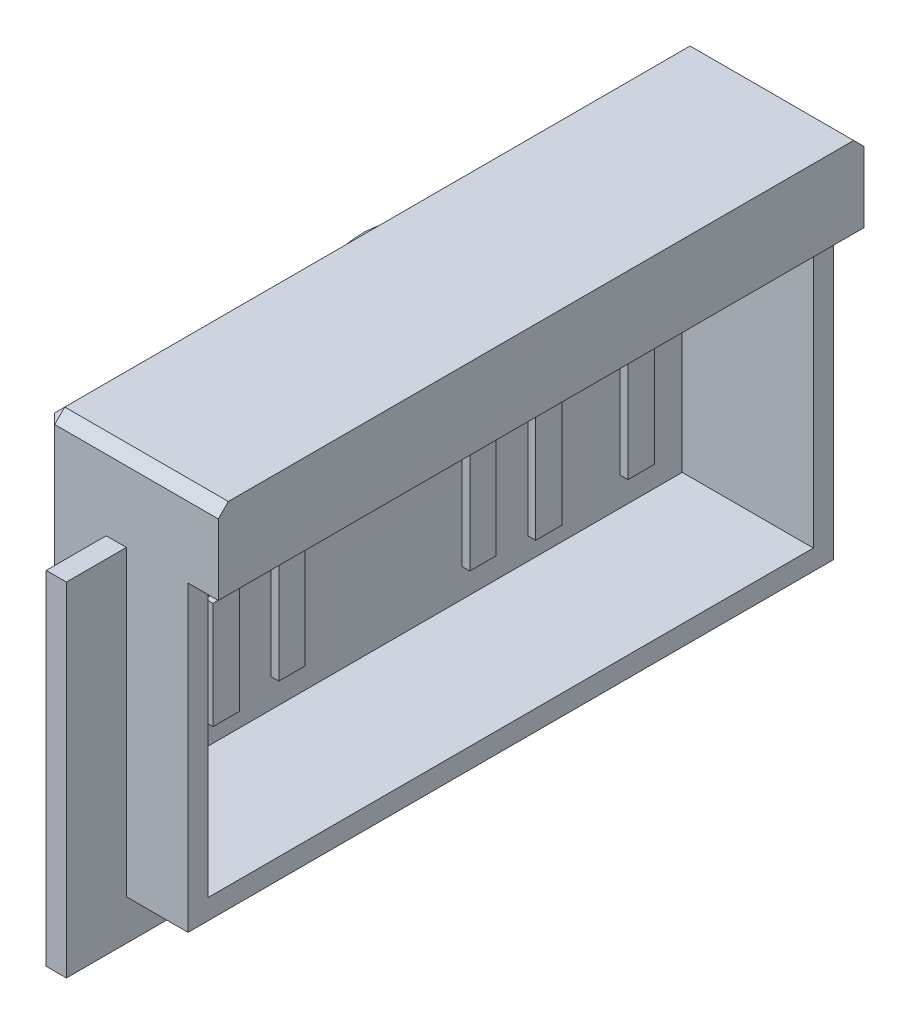
from build123d import *

# Parameters (mm, degrees)
EXTRUDE_1_DEPTH        = 38
SKETCH_2_W             = 60
SKETCH_2_H             = 34
CUT_EXTRUDE_1_DEPTH    = 13
SKETCH_3_R             = 5
SKETCH_3_W             = 2.616489735
SKETCH_3_H             = 10.586779654
SKETCH_3_W_2           = 2.616489734
CUT_EXTRUDE_4_DEPTH    = 31
SKETCH_4_W             = 2
SKETCH_4_H             = 75.8952895
EXTRUDE_3_DEPTH        = 4
SKETCH_5_W             = 5.94764475
SKETCH_5_H             = 8
CUT_EXTRUDE_5_DEPTH    = 4
SKETCH_6_W             = 64
SKETCH_6_H             = 8
EXTRUDE_4_DEPTH        = 3
SKETCH_8_W             = 4.58998673
SKETCH_8_H             = 12.393014206
SKETCH_8_W_2           = 2.616489734
SKETCH_8_H_2           = 10.586779654
EXTRUDE_12_DEPTH       = 0.5
SKETCH_8_W_3           = 4.589986731
SKETCH_8_W_4           = 2.616489735
EXTRUDE_12_2_DEPTH     = 0.5
EXTRUDE_12_3_DEPTH     = 0.5
EXTRUDE_12_4_DEPTH     = 0.5
SKETCH_8_W_5           = 2.638161598
SKETCH_8_H_3           = 10.599647323
EXTRUDE_12_5_DEPTH     = 0.5
EXTRUDE_12_6_DEPTH     = 0.5
EXTRUDE_5_DEPTH        = 1.5
EXTRUDE_5_DEPTH_BACK   = 2
SKETCH_7_W             = 2.616489735
SKETCH_7_H             = 10.586779654
EXTRUDE_5_2_DEPTH      = 1.5
EXTRUDE_5_2_DEPTH_BACK = 2
SKETCH_7_W_2           = 2.616489734
EXTRUDE_5_3_DEPTH      = 1.5
EXTRUDE_5_3_DEPTH_BACK = 2
EXTRUDE_5_4_DEPTH      = 1.5
EXTRUDE_5_4_DEPTH_BACK = 2
SKETCH_7_W_3           = 2.605653804
SKETCH_7_H_2           = 10.58034582
EXTRUDE_5_5_DEPTH      = 1.5
EXTRUDE_5_5_DEPTH_BACK = 2
EXTRUDE_5_6_DEPTH      = 1.5
EXTRUDE_5_6_DEPTH_BACK = 2
SKETCH_7_W_4           = 2.605653803
SKETCH_9_R             = 5
EXTRUDE_13_DEPTH       = 0.5
EXTRUDE_13_2_DEPTH     = 0.5
SKETCH_10_R            = 8.168620066
EXTRUDE_16_DEPTH       = 0.5
SKETCH_11_R            = 3.519491785
EXTRUDE_17_DEPTH       = 1
SKETCH_12_R            = 4.165923427
SKETCH_12_R_2          = 3.519491785
EXTRUDE_18_DEPTH       = 2
SKETCH_13_R            = 1.99985973
CUT_EXTRUDE_6_DEPTH    = 2
CHAMFER_1_SIZE         = 1


with BuildPart() as part:
    # 草图1 → 凸台-拉伸1 (new body)
    with BuildSketch(Plane(origin=(0, 0, 0), x_dir=(1, 0, 0), z_dir=(0, 1, 0))):
        Polygon((-2, 5.94764475), (-2, 0), (0, 0), (0, 5.94764475), (6.11103449, 5.94764475), (6.11103449, 69.94764475), (0, 69.94764475), (0, 75.8952895), (-2, 75.8952895), (-2, 69.94764475), (-8.11103449, 69.94764475), (-8.11103449, 5.94764475), align=None)
    extrude(amount=EXTRUDE_1_DEPTH)

    # 草图2 → 切除-拉伸1 (cut)
    with BuildSketch(Plane(origin=(6.11103449, 0, 0), x_dir=(0, 0, -1), z_dir=(1, 0, 0))):
        with Locations((37.94764475, 19)):
            Rectangle(SKETCH_2_W, SKETCH_2_H)
    extrude(amount=-CUT_EXTRUDE_1_DEPTH, mode=Mode.SUBTRACT)

    # 草图3 → 切除-拉伸4 (cut)
    with BuildSketch(Plane.ZY.offset(8.11103449)):
        with Locations((-53.94764475, 28.5)):
            Circle(SKETCH_3_R)
        with Locations((-63.098105483, 10.137074157)):
            Rectangle(SKETCH_3_W, SKETCH_3_H)
        with Locations((-47.413673753, 10.137074157)):
            Rectangle(SKETCH_3_W, SKETCH_3_H)
        with BuildLine():
            ThreePointArc((-46.105428885, 28.079391153), (-29.781734116, 28.710374202), (-46.116264816, 28.5))
            Line((-46.116264816, 28.5), (-46.105428885, 28.5))
            Line((-46.105428885, 28.5), (-46.105428885, 28.079391153))
        make_face()
        with Locations((-28.470779817, 10.143507991)):
            Rectangle(SKETCH_3_W, SKETCH_3_H)
        with Locations((-53.94764475, 9.5)):
            Rectangle(SKETCH_3_W_2, SKETCH_3_H)
        with Locations((-21.94764475, 28.5)):
            Circle(SKETCH_3_R)
        with Locations((-12.808019949, 10.143507991)):
            Rectangle(SKETCH_3_W_2, SKETCH_3_H)
        with Locations((-21.94764475, 9.5)):
            Rectangle(SKETCH_3_W_2, SKETCH_3_H)
    extrude(amount=-CUT_EXTRUDE_4_DEPTH, mode=Mode.SUBTRACT)

    # 草图4 → 凸台-拉伸3 (add)
    with BuildSketch(Plane.XZ):
        with Locations((-1, -37.94764475)):
            Rectangle(SKETCH_4_W, SKETCH_4_H)
    extrude(amount=EXTRUDE_3_DEPTH)

    # 草图5 → 切除-拉伸5 (cut)
    with BuildSketch(Plane.ZY.offset(2)):
        with Locations((-72.921467125, 34)):
            Rectangle(SKETCH_5_W, SKETCH_5_H)
        with Locations((-2.973822375, 34)):
            Rectangle(SKETCH_5_W, SKETCH_5_H)
    extrude(amount=-CUT_EXTRUDE_5_DEPTH, mode=Mode.SUBTRACT)

    # 草图6 → 凸台-拉伸4 (add)
    with BuildSketch(Plane(origin=(6.11103449, 0, 0), x_dir=(0, 0, -1), z_dir=(1, 0, 0))):
        with Locations((37.94764475, 34)):
            Rectangle(SKETCH_6_W, SKETCH_6_H)
    extrude(amount=EXTRUDE_4_DEPTH)

    # 倒角1
    chamfer_1_edges = [part.edges().sort_by_distance(p)[0] for p in [
        (-8.11103449, 19, -69.94764475),
        (-8.11103449, 38, -37.94764475),
        (-8.11103449, 19, -5.94764475),
        (-8.11103449, 0, -37.94764475),
        (0.5, 38, -5.94764475),
        (0.5, 38, -69.94764475),
    ]]
    chamfer(chamfer_1_edges, length=CHAMFER_1_SIZE)


with BuildPart() as body_2:
    # 草图8 → 凸台-拉伸12 (new body)
    with BuildSketch(Plane.ZY.offset(8.11103449)):
        with Locations((-53.94764475, 9.5)):
            Rectangle(SKETCH_8_W, SKETCH_8_H)
        with Locations((-53.94764475, 9.5)):
            Rectangle(SKETCH_8_W_2, SKETCH_8_H_2, mode=Mode.SUBTRACT)
    extrude(amount=EXTRUDE_12_DEPTH)


with BuildPart() as body_3:
    # 草图8 → Extrude 12 2 (new body)
    with BuildSketch(Plane.ZY.offset(8.11103449)):
        with Locations((-63.098105483, 10.137074157)):
            Rectangle(SKETCH_8_W_3, SKETCH_8_H)
        with Locations((-63.098105483, 10.137074157)):
            Rectangle(SKETCH_8_W_4, SKETCH_8_H_2, mode=Mode.SUBTRACT)
    extrude(amount=EXTRUDE_12_2_DEPTH)


with BuildPart() as body_4:
    # 草图8 → Extrude 12 3 (new body)
    with BuildSketch(Plane.ZY.offset(8.11103449)):
        with Locations((-47.413673753, 10.137074157)):
            Rectangle(SKETCH_8_W_3, SKETCH_8_H)
        with Locations((-47.413673753, 10.137074157)):
            Rectangle(SKETCH_8_W_4, SKETCH_8_H_2, mode=Mode.SUBTRACT)
    extrude(amount=EXTRUDE_12_3_DEPTH)


with BuildPart() as body_5:
    # 草图8 → Extrude 12 4 (new body)
    with BuildSketch(Plane.ZY.offset(8.11103449)):
        with Locations((-21.94764475, 9.5)):
            Rectangle(SKETCH_8_W, SKETCH_8_H)
        with Locations((-21.94764475, 9.5)):
            Rectangle(SKETCH_8_W_2, SKETCH_8_H_2, mode=Mode.SUBTRACT)
    extrude(amount=EXTRUDE_12_4_DEPTH)


with BuildPart() as body_6:
    # 草图8 → Extrude 12 5 (new body)
    with BuildSketch(Plane.ZY.offset(8.11103449)):
        with Locations((-28.481615748, 10.137074157)):
            Rectangle(SKETCH_8_W_3, SKETCH_8_H)
        with Locations((-28.481615748, 10.137074157)):
            Rectangle(SKETCH_8_W_5, SKETCH_8_H_3, mode=Mode.SUBTRACT)
    extrude(amount=EXTRUDE_12_5_DEPTH)


with BuildPart() as body_7:
    # 草图8 → Extrude 12 6 (new body)
    with BuildSketch(Plane.ZY.offset(8.11103449)):
        with Locations((-12.797184018, 10.137074157)):
            Rectangle(SKETCH_8_W_3, SKETCH_8_H)
        Polygon((-11.48893915, 4.84368433), (-14.105428885, 4.84368433), (-14.105428885, 4.850118164), (-14.116264816, 4.850118164), (-14.116264816, 15.436897818), (-11.499775082, 15.436897818), (-11.499775082, 15.430463984), (-11.48893915, 15.430463984), align=None, mode=Mode.SUBTRACT)
    extrude(amount=EXTRUDE_12_6_DEPTH)


with BuildPart() as body_8:
    # 草图7 → 凸台-拉伸5 (new, two sides: drawn at the far end of the back side and taken through both)
    with BuildSketch(Plane.ZY.offset(8.11103449).offset(-EXTRUDE_5_DEPTH_BACK)):
        with Locations((-63.098105483, 10.137074157)):
            Rectangle(SKETCH_7_W, SKETCH_7_H)
    extrude(amount=EXTRUDE_5_DEPTH + EXTRUDE_5_DEPTH_BACK)


with BuildPart() as body_9:
    # 草图7 → Extrude 5 2 (new, two sides: drawn at the far end of the back side and taken through both)
    with BuildSketch(Plane.ZY.offset(8.11103449).offset(-EXTRUDE_5_2_DEPTH_BACK)):
        with Locations((-53.94764475, 9.5)):
            Rectangle(SKETCH_7_W_2, SKETCH_7_H)
    extrude(amount=EXTRUDE_5_2_DEPTH + EXTRUDE_5_2_DEPTH_BACK)


with BuildPart() as body_10:
    # 草图7 → Extrude 5 3 (new, two sides: drawn at the far end of the back side and taken through both)
    with BuildSketch(Plane.ZY.offset(8.11103449).offset(-EXTRUDE_5_3_DEPTH_BACK)):
        with Locations((-47.413673753, 10.137074157)):
            Rectangle(SKETCH_7_W, SKETCH_7_H)
    extrude(amount=EXTRUDE_5_3_DEPTH + EXTRUDE_5_3_DEPTH_BACK)


with BuildPart() as body_11:
    # 草图7 → Extrude 5 4 (new, two sides: drawn at the far end of the back side and taken through both)
    with BuildSketch(Plane.ZY.offset(8.11103449).offset(-EXTRUDE_5_4_DEPTH_BACK)):
        with Locations((-28.476197782, 10.140291074)):
            Rectangle(SKETCH_7_W_3, SKETCH_7_H_2)
    extrude(amount=EXTRUDE_5_4_DEPTH + EXTRUDE_5_4_DEPTH_BACK)


with BuildPart() as body_12:
    # 草图7 → Extrude 5 5 (new, two sides: drawn at the far end of the back side and taken through both)
    with BuildSketch(Plane.ZY.offset(8.11103449).offset(-EXTRUDE_5_5_DEPTH_BACK)):
        with Locations((-21.94764475, 9.5)):
            Rectangle(SKETCH_7_W_2, SKETCH_7_H)
    extrude(amount=EXTRUDE_5_5_DEPTH + EXTRUDE_5_5_DEPTH_BACK)


with BuildPart() as body_13:
    # 草图7 → Extrude 5 6 (new, two sides: drawn at the far end of the back side and taken through both)
    with BuildSketch(Plane.ZY.offset(8.11103449).offset(-EXTRUDE_5_6_DEPTH_BACK)):
        with Locations((-12.802601984, 10.140291074)):
            Rectangle(SKETCH_7_W_4, SKETCH_7_H_2)
    extrude(amount=EXTRUDE_5_6_DEPTH + EXTRUDE_5_6_DEPTH_BACK)


with BuildPart() as body_14:
    # 草图9 → 凸台-拉伸13 (new body)
    with BuildSketch(Plane.ZY.offset(8.11103449)):
        with Locations((-53.94764475, 28.5)):
            Circle(SKETCH_9_R)
    extrude(amount=EXTRUDE_13_DEPTH)


with BuildPart() as body_15:
    # 草图9 → Extrude 13 2 (new body)
    with BuildSketch(Plane.ZY.offset(8.11103449)):
        with Locations((-21.94764475, 28.5)):
            Circle(SKETCH_9_R)
    extrude(amount=EXTRUDE_13_2_DEPTH)


with BuildPart() as body_16:
    # 草图10 → 凸台-拉伸16 (new body)
    with BuildSketch(Plane.ZY.offset(8.11103449)):
        with Locations((-37.94764475, 28.5)):
            Circle(SKETCH_10_R)
    extrude(amount=EXTRUDE_16_DEPTH)

    # 草图11 → 凸台-拉伸17 (add)
    with BuildSketch(Plane.ZY.offset(8.61103449)):
        with Locations((-37.94764475, 28.5)):
            Circle(SKETCH_11_R)
    extrude(amount=EXTRUDE_17_DEPTH)

    # 草图12 → 凸台-拉伸18 (add)
    with BuildSketch(Plane.ZY.offset(8.61103449)):
        with Locations((-37.94764475, 28.5)):
            Circle(SKETCH_12_R)
        with Locations((-37.94764475, 28.5)):
            Circle(SKETCH_12_R_2, mode=Mode.SUBTRACT)
    extrude(amount=EXTRUDE_18_DEPTH)

    # 草图13 → 切除-拉伸6 (cut)
    with BuildSketch(Plane.ZY.offset(9.61103449)):
        with Locations((-37.94764475, 28.5)):
            Circle(SKETCH_13_R)
    extrude(amount=-CUT_EXTRUDE_6_DEPTH, mode=Mode.SUBTRACT)


solid = Compound([part.part, body_2.part, body_3.part, body_4.part, body_5.part, body_6.part, body_7.part, body_8.part, body_9.part, body_10.part, body_11.part, body_12.part, body_13.part, body_14.part, body_15.part, body_16.part])
